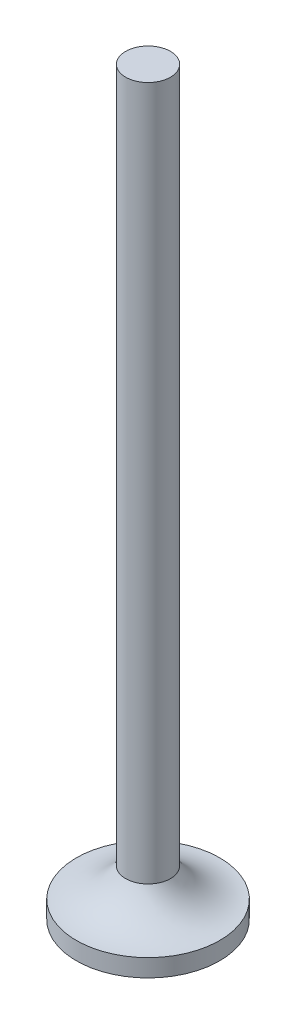
from build123d import *


with BuildPart() as part:
    # Sketch1 → Revolve1 (revolve)
    with BuildSketch(Plane.XY):
        with BuildLine():
            Line((0, 0), (10.16, 0))
            Line((10.16, 0), (10.16, 2.5))
            ThreePointArc((10.16, 2.5), (6.110294408, 3.600733038), (3.175, 6.600028846))
            Line((3.175, 6.600028846), (3.175, 105))
            Line((3.175, 105), (0, 105))
            Line((0, 105), (0, 0))
        make_face()
    revolve(axis=Axis((0, -31.831703756, 0), (0, 1, 0)))


solid = part.part
